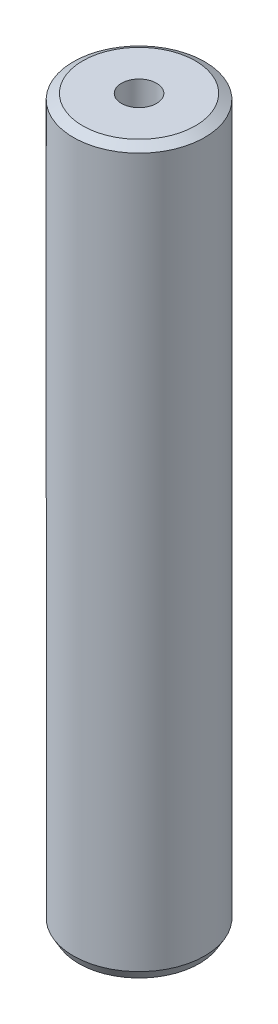
from build123d import *
from OCP.BRepFilletAPI import BRepFilletAPI_MakeChamfer

# Parameters (mm, degrees)
SKETCH1_R           = 10
BOSS_EXTRUDE1_DEPTH = 110.168941236
SKETCH2_R           = 2.671942024
CUT_EXTRUDE1_DEPTH  = 112.072929254
CHAMFER1_SIZE       = 0.821711151
CHAMFER1_SIZE2      = 1.423245462


with BuildPart() as part:
    # Sketch1 → Boss-Extrude1 (new body)
    with BuildSketch(Plane(origin=(0, 0, 0), x_dir=(1, 0, 0), z_dir=(0, 1, 0))):
        Circle(SKETCH1_R)
    extrude(amount=BOSS_EXTRUDE1_DEPTH)

    # Sketch2 → Cut-Extrude1 (cut, through all)
    with BuildSketch(Plane(origin=(0, 0, 0), x_dir=(1, 0, 0), z_dir=(0, 1, 0))):
        Circle(SKETCH2_R)
    extrude(amount=CUT_EXTRUDE1_DEPTH, mode=Mode.SUBTRACT)

    # Chamfer1: one chamfer whose edges measure the first distance from different faces: ONE call of the kernel's chamfer builder (chamfer() names one face for all edges)
    chamfer1_edges_1 = [part.edges().sort_by_distance(p)[0] for p in [
        (-10, 110.168941236, 0),
    ]]
    chamfer1_side_1 = [part.faces().sort_by_distance(p)[0] for p in [
        (-10, 55.084470618, 0),
    ]]
    chamfer1_edges_2 = [part.edges().sort_by_distance(p)[0] for p in [
        (-10, 0, 0),
    ]]
    chamfer1_side_2 = [part.faces().sort_by_distance(p)[0] for p in [
        (-9.717157288, 0, 0),
    ]]
    chamfer1 = BRepFilletAPI_MakeChamfer(part.part.solid().wrapped)
    for e in chamfer1_edges_1:
        chamfer1.Add(CHAMFER1_SIZE, CHAMFER1_SIZE2, e.wrapped, chamfer1_side_1[0].wrapped)  # the first distance lies on this face
    for e in chamfer1_edges_2:
        chamfer1.Add(CHAMFER1_SIZE, CHAMFER1_SIZE2, e.wrapped, chamfer1_side_2[0].wrapped)  # the first distance lies on this face
    add(Compound.cast(chamfer1.Shape()), mode=Mode.REPLACE)


solid = part.part
